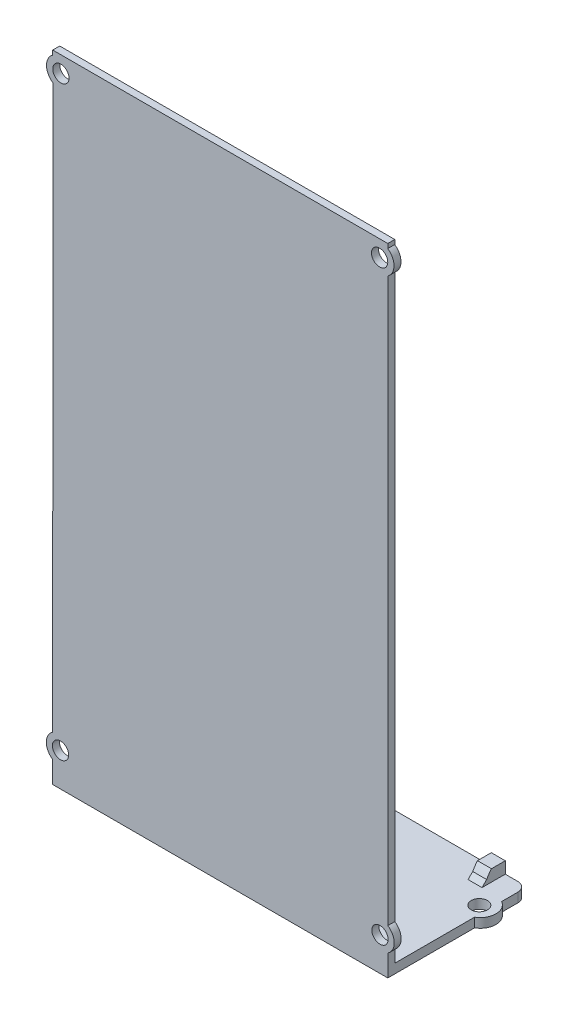
from build123d import *

# Parameters (mm, degrees)
SKETCH1_R                = 1.75
BOSS_EXTRUDE1_DEPTH      = 1.5
BOSS_EXTRUDE2_DEPTH      = 72
BOSS_EXTRUDE3_DEPTH      = 1.5
BOSS_EXTRUDE3_DEPTH_BACK = 1.5
BOSS_EXTRUDE4_DEPTH      = 2
SKETCH5_R                = 1.75
CUT_EXTRUDE1_DEPTH       = 2
CUT_EXTRUDE2_DEPTH       = 148.332054879
CUT_EXTRUDE2_DEPTH_BACK  = 148.332054879
SKETCH6_W                = 72
SKETCH6_H                = 11.553195909
BOSS_EXTRUDE6_START      = -2
SKETCH7_W                = 3
SKETCH7_H                = 4
BOSS_EXTRUDE6_DEPTH      = 2.5
FILLET1_R                = 2
CHAMFER1_SIZE            = 1
FILLET2_R                = 8
SKETCH8_W                = 35
SKETCH8_H                = 19.946804091
CUT_EXTRUDE3_DEPTH       = 22.4262221


with BuildPart() as part:
    # Sketch1 → Boss-Extrude1 (new body)
    with BuildSketch(Plane.XY):
        with BuildLine():
            Line((-31.5, -134.5), (31.5, -134.5))
            Line((31.5, -134.5), (36, -134.5))
            Line((36, -134.5), (36, -132.049019419))
            ThreePointArc((36, -132.049019419), (37.374296294, -129.5), (36, -126.950980581))
            Line((36, -126.950980581), (36, -6.049019419))
            ThreePointArc((36, -6.049019419), (37.33874188, -3.5), (36, -0.950980581))
            Line((36, -0.950980581), (36, 0))
            Line((36, 0), (-36, 0))
            Line((-36, 0), (-36, -0.950980581))
            ThreePointArc((-36, -0.950980581), (-37.339851511, -3.504206195), (-35.994020506, -6.054285021))
            Line((-35.994020506, -6.054285021), (-36, -126.950980581))
            ThreePointArc((-36, -126.950980581), (-37.376731289, -129.5), (-36, -132.049019419))
            Line((-36, -132.049019419), (-36, -134.5))
            Line((-36, -134.5), (-31.5, -134.5))
        make_face()
        with Locations((-34.328609587, -129.5)):
            Circle(SKETCH1_R, mode=Mode.SUBTRACT)
        with Locations((34.323211043, -129.5)):
            Circle(SKETCH1_R, mode=Mode.SUBTRACT)
        with Locations((34.242652207, -3.5)):
            Circle(SKETCH1_R, mode=Mode.SUBTRACT)
        with Locations((-34.244120111, -3.500578956)):
            Circle(SKETCH1_R, mode=Mode.SUBTRACT)
    extrude(amount=BOSS_EXTRUDE1_DEPTH)

    # Sketch2 → Boss-Extrude2 (add)
    with BuildSketch(Plane.ZY.offset(36)):
        Polygon((1.5, -134.5), (1.5, -136.7), (-40, -136.7), (-40, -134.7), (0, -134.7), (0, -134.5), (0, -132.049019419), (1.5, -132.049019419), align=None)
    extrude(amount=-BOSS_EXTRUDE2_DEPTH)

    # Sketch3 → Boss-Extrude3 (add, two sides: drawn at the far end of the back side and taken through both)
    with BuildSketch(Plane(origin=(0, 0, 0), x_dir=(0, 0, -1), z_dir=(1, 0, 0)).offset(-BOSS_EXTRUDE3_DEPTH_BACK)):
        Polygon((0, -119.7), (15, -134.7), (0, -134.7), align=None)
    extrude(amount=BOSS_EXTRUDE3_DEPTH + BOSS_EXTRUDE3_DEPTH_BACK)

    # Sketch4 → Boss-Extrude4 (add)
    with BuildSketch(Plane.XZ.offset(136.7)):
        with BuildLine():
            Line((-36, -17.152805247), (-36, -22.963011674))
            ThreePointArc((-36, -22.963011674), (-37.650416645, -20.05790846), (-36, -17.152805247))
        make_face()
        with BuildLine():
            Line((36, -17.152805247), (36, -22.963011674))
            ThreePointArc((36, -22.963011674), (37.68082264, -20.05790846), (36, -17.152805247))
        make_face()
    extrude(amount=-BOSS_EXTRUDE4_DEPTH)

    # Sketch5 → Cut-Extrude1 (cut)
    with BuildSketch(Plane.XZ.offset(136.7)):
        with Locations(Location((-34.253947115, -19.946804091, 0), (0, 0, 270))):
            Circle(SKETCH5_R)
        with Locations(Location((34.288977705, -19.889159472, 0), (0, 0, 270))):
            Circle(SKETCH5_R)
    extrude(amount=-CUT_EXTRUDE1_DEPTH, mode=Mode.SUBTRACT)

    # Sketch6 → Cut-Extrude2 (cut, two sides: drawn at the far end of the back side and taken through both)
    with BuildSketch(Plane.XZ.offset(136.7).offset(-CUT_EXTRUDE2_DEPTH_BACK)):
        with Locations((0, -34.223402046)):
            Rectangle(SKETCH6_W, SKETCH6_H)
    extrude(amount=CUT_EXTRUDE2_DEPTH + CUT_EXTRUDE2_DEPTH_BACK, mode=Mode.SUBTRACT)

    # Sketch7 → Boss-Extrude6 (add)
    with BuildSketch(Plane.XZ.offset(136.7).offset(BOSS_EXTRUDE6_START)):
        with Locations((-29.8, -26.446804091)):
            Rectangle(SKETCH7_W, SKETCH7_H)
        with Locations((29.8, -26.446804091)):
            Rectangle(SKETCH7_W, SKETCH7_H)
    extrude(amount=-BOSS_EXTRUDE6_DEPTH)

    # Fillet1
    fillet1_edges = [part.edges().sort_by_distance(p)[0] for p in [
        (36, -135.7, -28.446804091),
        (-36, -135.7, -28.446804091),
    ]]
    fillet(fillet1_edges, radius=FILLET1_R)

    # Chamfer1
    chamfer1_edges = [part.edges().sort_by_distance(p)[0] for p in [
        (-29.8, -134.7, -24.446804091),
        (-29.8, -132.2, -24.446804091),
        (29.8, -134.7, -24.446804091),
        (29.8, -132.2, -24.446804091),
    ]]
    chamfer(chamfer1_edges, length=CHAMFER1_SIZE)

    # Fillet2
    # the kernel refuses this fillet: 8 mm, written as the material it takes off along each edge
    with BuildSketch(Plane(origin=(-23.303909917, -133.2, -24.446804091), x_dir=(0, -1.0, -1.118394266079786e-11), z_dir=(-1, 0, 0))) as fillet2_piece_1:
        with BuildLine():
            CenterArc((4.243746579, -7.06996192), FILLET2_R, 117.902496562, 17.097503438)
            Line((-1.413107671, -1.413107671), (0, 0))
            Line((0, 0), (0.5, 0))
        make_face()
    extrude(amount=12.992180166, mode=Mode.SUBTRACT)
    with BuildSketch(Plane(origin=(23.303909917, -133.2, -24.446804091), x_dir=(0, 0.7071067811865476, -0.7071067811865476), z_dir=(1, 0, 0))) as fillet2_piece_2:
        with BuildLine():
            CenterArc((1.998436033, -8), FILLET2_R, 90, 17.097503438)
            Line((-0.353553391, -0.353553391), (0, 0))
            Line((0, 0), (1.998436033, 0))
        make_face()
    extrude(amount=12.992180166, mode=Mode.SUBTRACT)

    # Sketch8 → Cut-Extrude3 (cut)
    with BuildSketch(Plane.XZ.offset(136.7)):
        with Locations((-13.5, -15.473402046)):
            Rectangle(SKETCH8_W, SKETCH8_H)
    extrude(amount=-CUT_EXTRUDE3_DEPTH, mode=Mode.SUBTRACT)


solid = part.part
